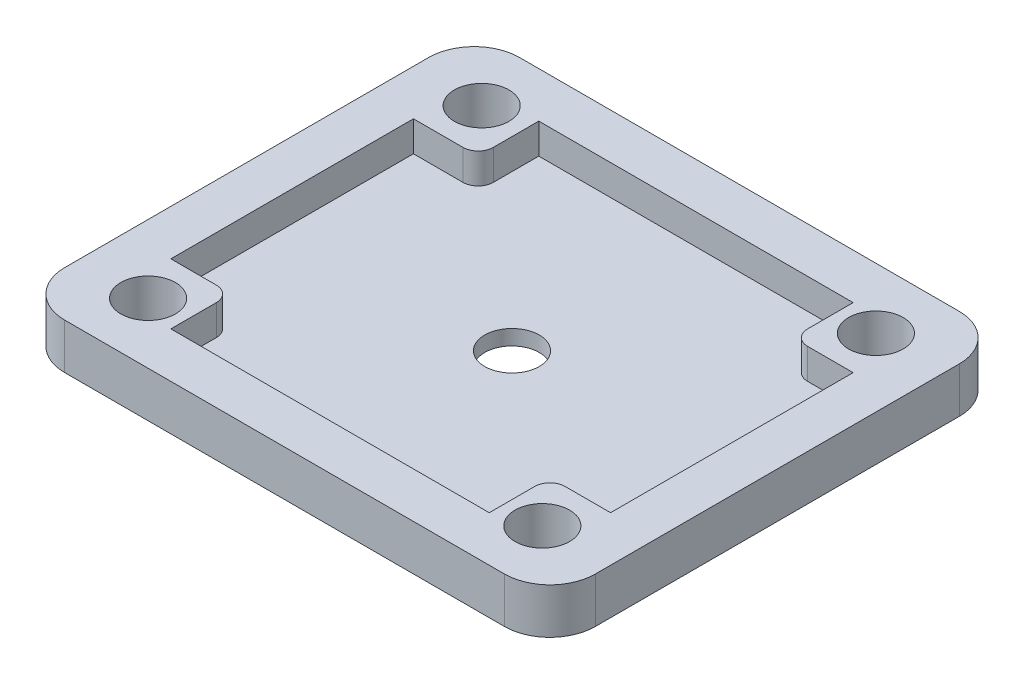
from build123d import *

# Parameters (mm, degrees)
SKETCH1_W            = 35
SKETCH1_H            = 30
BOSS_EXTRUDE1_DEPTH  = 3
SKETCH2_W            = 29
SKETCH2_H            = 24
CUT_EXTRUDE1_DEPTH   = 2
SKETCH5_W            = 4.266255033
SKETCH5_H            = 4
SKETCH5_W_2          = 4
BOSS_EXTRUDE2_DEPTH  = 2
M3_CLEARANCE_HOLE1_D = 3.6
FILLET1_R            = 3
FILLET2_R            = 1


with BuildPart() as part:
    # Sketch1 → Boss-Extrude1 (new body)
    with BuildSketch(Plane(origin=(0, 0, 0), x_dir=(1, 0, 0), z_dir=(0, 1, 0))):
        Rectangle(SKETCH1_W, SKETCH1_H)
    extrude(amount=BOSS_EXTRUDE1_DEPTH)

    # Sketch2 → Cut-Extrude1 (cut)
    with BuildSketch(Plane(origin=(0, 3, 0), x_dir=(1, 0, 0), z_dir=(0, 1, 0))):
        Rectangle(SKETCH2_W, SKETCH2_H)
    extrude(amount=-CUT_EXTRUDE1_DEPTH, mode=Mode.SUBTRACT)

    # Sketch5 → Boss-Extrude2 (add)
    with BuildSketch(Plane(origin=(0, 1, 0), x_dir=(1, 0, 0), z_dir=(0, 1, 0))):
        with Locations((-12.366872483, 10)):
            Rectangle(SKETCH5_W, SKETCH5_H)
        with Locations((12.5, 10)):
            Rectangle(SKETCH5_W_2, SKETCH5_H)
        with Locations((12.5, -10)):
            Rectangle(SKETCH5_W_2, SKETCH5_H)
        with Locations((-12.5, -10)):
            Rectangle(SKETCH5_W_2, SKETCH5_H)
    extrude(amount=BOSS_EXTRUDE2_DEPTH)

    # M3 Clearance Hole1 (through all)
    with Locations(Plane(origin=(0, 3, 0), x_dir=(1, 0, 0), z_dir=(0, 1, 0))):
        with Locations((0, 0), (13, 11), (-13, -11), (-13, 11), (13, -11)):
            Hole(M3_CLEARANCE_HOLE1_D / 2)

    # Fillet1
    fillet1_edges = [part.edges().sort_by_distance(p)[0] for p in [
        (17.5, 1.5, 15),
        (-17.5, 1.5, 15),
        (-17.5, 1.5, -15),
        (17.5, 1.5, -15),
    ]]
    fillet(fillet1_edges, radius=FILLET1_R)

    # Fillet2
    fillet2_edges = [part.edges().sort_by_distance(p)[0] for p in [
        (-10.5, 2, 8),
        (10.5, 2, 8),
        (10.5, 2, -8),
        (-10.233744967, 2, -8),
    ]]
    fillet(fillet2_edges, radius=FILLET2_R)


solid = part.part
